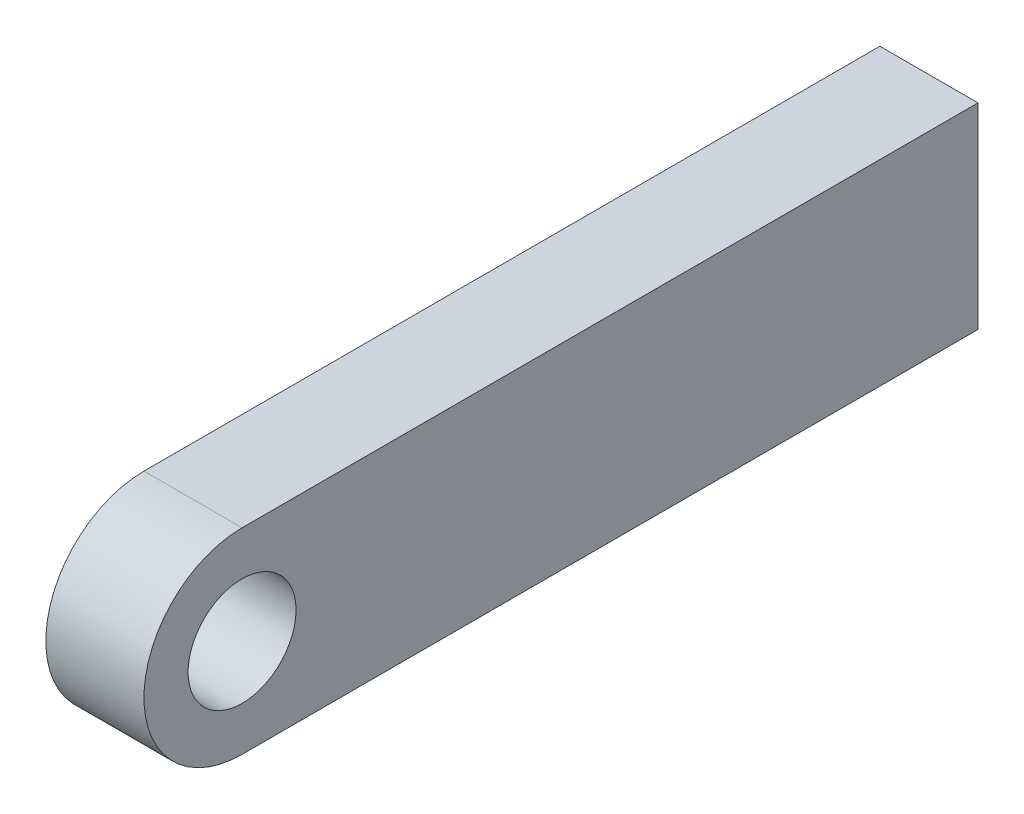
from build123d import *

# Parameters (mm, degrees)
SKETCH_4_R      = 11
EXTRUDE_2_DEPTH = 20


with BuildPart() as part:
    # Эскиз4 → Бобышка-Вытянуть2 (new body)
    with BuildSketch(Plane(origin=(0, 0, 0), x_dir=(0, 0, -1), z_dir=(1, 0, 0))):
        with BuildLine():
            Line((0, 40), (-150, 40))
            ThreePointArc((-150, 40), (-170, 20), (-150, 0))
            Line((-150, 0), (0, 0))
            Line((0, 0), (0, 40))
        make_face()
        with Locations((-150, 20)):
            Circle(SKETCH_4_R, mode=Mode.SUBTRACT)
    extrude(amount=EXTRUDE_2_DEPTH)


solid = part.part
